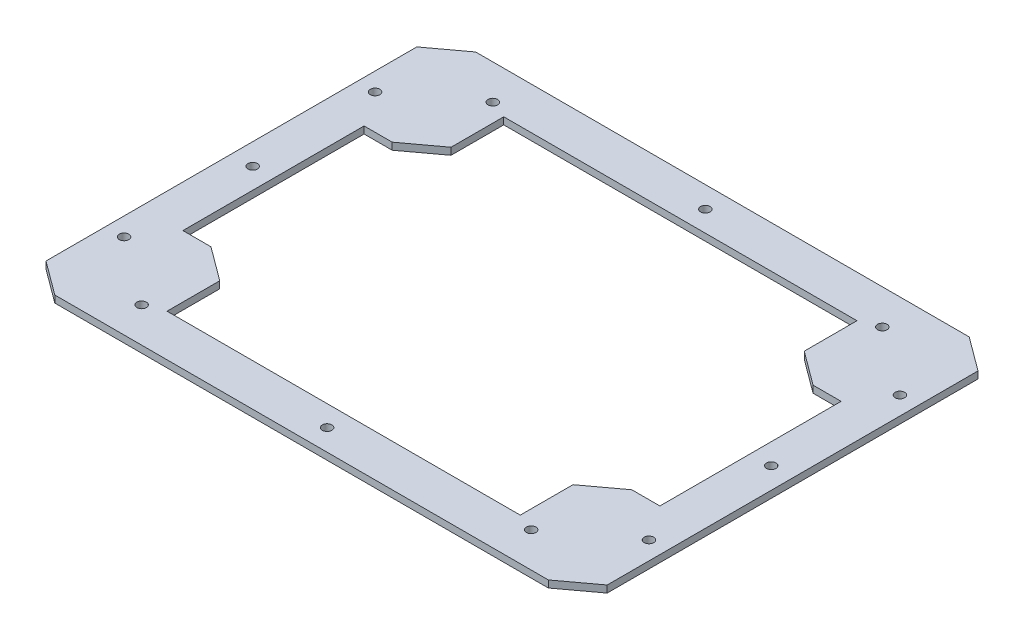
from build123d import *

# Parameters (mm, degrees)
BOSS_EXTRUDE1_DEPTH = 3.175
SKETCH2_R           = 2.159
CUT_EXTRUDE1_DEPTH  = 159.781746826


with BuildPart() as part:
    # Sketch1 → Boss-Extrude1 (new body)
    with BuildSketch(Plane(origin=(0, 0, 0), x_dir=(1, 0, 0), z_dir=(0, 1, 0))):
        Polygon((-111.686526805, 95.25), (-127, 83.918625912), (-127, -83.918625912), (-111.686526805, -95.25), (111.686526805, -95.25), (127, -83.918625912), (127, 83.918625912), (111.686526805, 95.25), align=None)
        Polygon((-107.95, -41.010963508), (-107.95, 41.010963508), (-95.25, 41.010963508), (-79.936526805, 52.342337595), (-79.936526805, 76.2), (38.831798823, 76.2), (79.936526805, 76.2), (79.936526805, 52.342337595), (95.25, 41.010963508), (107.95, 41.010963508), (107.95, -41.010963508), (95.25, -41.010963508), (79.936526805, -52.342337595), (79.936526805, -76.2), (38.1, -76.2), (-79.936526805, -76.2), (-79.936526805, -52.342337595), (-95.25, -41.010963508), align=None, mode=Mode.SUBTRACT)
    extrude(amount=BOSS_EXTRUDE1_DEPTH)

    # Sketch2 → Cut-Extrude1 (cut, through all)
    with BuildSketch(Plane(origin=(0, 3.175, 0), x_dir=(1, 0, 0), z_dir=(0, 1, 0))):
        with Locations((-88.154790208, 79.461855841)):
            Circle(SKETCH2_R)
        with Locations((88.154790208, 79.461855841)):
            Circle(SKETCH2_R)
        with Locations((88.154790208, -79.461855841)):
            Circle(SKETCH2_R)
        with Locations((-88.154790208, -79.461855841)):
            Circle(SKETCH2_R)
        with Locations((-118.781736597, 56.799107666)):
            Circle(SKETCH2_R)
        with Locations((118.781736597, 56.799107666)):
            Circle(SKETCH2_R)
        with Locations((-118.781736597, -56.799107666)):
            Circle(SKETCH2_R)
        with Locations((118.781736597, -56.799107666)):
            Circle(SKETCH2_R)
        with Locations((1.927689224, -85.598)):
            Circle(SKETCH2_R)
        with Locations((1.927689224, 85.598)):
            Circle(SKETCH2_R)
        with Locations((-117.348, -0.020516524)):
            Circle(SKETCH2_R)
        with Locations((117.348, -0.020516524)):
            Circle(SKETCH2_R)
    extrude(amount=-CUT_EXTRUDE1_DEPTH, mode=Mode.SUBTRACT)


solid = part.part
